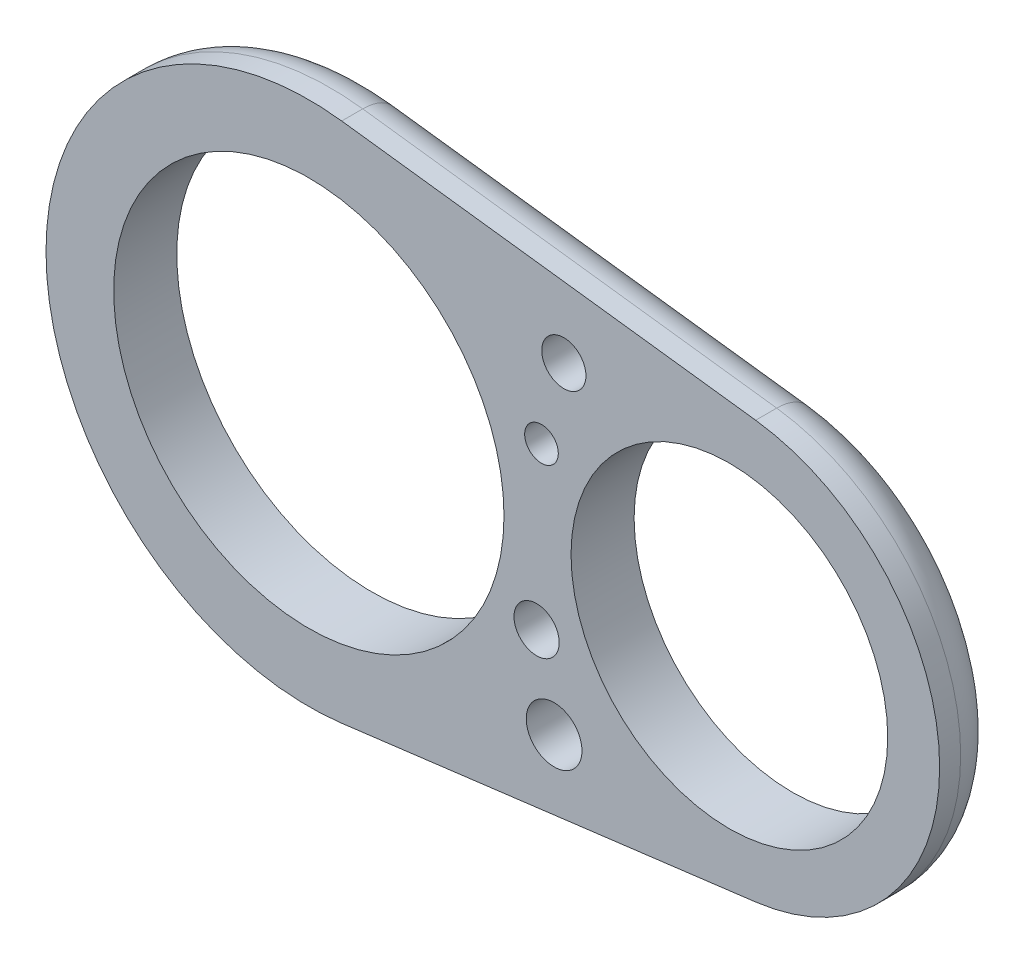
from build123d import *

# Parameters (mm, degrees)
SKETCH1_R           = 2.15
SKETCH1_R_2         = 1.6
SKETCH1_R_3         = 2.1
SKETCH1_R_4         = 2.65
SKETCH1_R_5         = 18.5625
SKETCH1_R_6         = 15.0625
BOSS_EXTRUDE1_DEPTH = 6
FILLET1_R           = 4


with BuildPart() as part:
    # Sketch1 → Boss-Extrude1 (new body)
    with BuildSketch(Plane.XY):
        with BuildLine():
            Line((3.125, -24.803918541), (42.5, -19.843134833))
            ThreePointArc((42.5, -19.843134833), (60, 0), (42.5, 19.843134833))
            Line((42.5, 19.843134833), (3.125, 24.803918541))
            ThreePointArc((3.125, 24.803918541), (-25, 0), (3.125, -24.803918541))
        make_face()
        with Locations((21.663293527, -7.825180806)):
            Circle(SKETCH1_R, mode=Mode.SUBTRACT)
        with Locations((22.126671777, 7.712150618)):
            Circle(SKETCH1_R_2, mode=Mode.SUBTRACT)
        with Locations((24.253343554, 15.424301236)):
            Circle(SKETCH1_R_3, mode=Mode.SUBTRACT)
        with Locations((23.326587053, -15.650361612)):
            Circle(SKETCH1_R_4, mode=Mode.SUBTRACT)
        Circle(SKETCH1_R_5, mode=Mode.SUBTRACT)
        with Locations((40, 0)):
            Circle(SKETCH1_R_6, mode=Mode.SUBTRACT)
    extrude(amount=BOSS_EXTRUDE1_DEPTH)

    # Fillet1
    # the kernel refuses this fillet: 4 mm, written as the material it takes off along each edge
    with BuildSketch(Plane(origin=(0, 0, 0), x_dir=(0.12499999999999982, 0.9921567416492215, 0), z_dir=(0.9921567416492215, -0.12499999999999982, 0))) as fillet1_piece_1:
        with BuildLine():
            CenterArc((25 - FILLET1_R, FILLET1_R), FILLET1_R, 270, 90)
            Line((25 - FILLET1_R, 0), (25, 0))
            Line((25, 0), (25, FILLET1_R))
        make_face()
    revolve(axis=Axis((0, 0, 0), (0, 0, 1)), revolution_arc=194.361511563, mode=Mode.SUBTRACT)
    with BuildSketch(Plane(origin=(42.5, 19.843134833, 0), x_dir=(0, 0, 1), z_dir=(-0.9921567416492215, 0.12500000000000022, 0)), Plane(origin=(3.125, -24.803918541, 0), x_dir=(0, 0, 1), z_dir=(0.9921567416492215, 0.12500000000000014, 0))) as fillet1_piece_2:
        with BuildLine():
            CenterArc((FILLET1_R, -FILLET1_R), FILLET1_R, 90, 90)
            Line((0, -FILLET1_R), (0, 0))
            Line((0, 0), (FILLET1_R, 0))
        make_face()
    extrude(amount=39.686269666, mode=Mode.SUBTRACT)
    with BuildSketch(Plane(origin=(40, 0, 0), x_dir=(0.12499999999999938, -0.9921567416492216, 0), z_dir=(-0.9921567416492216, -0.12499999999999938, 0))) as fillet1_piece_3:
        with BuildLine():
            CenterArc((20 - FILLET1_R, FILLET1_R), FILLET1_R, 270, 90)
            Line((20 - FILLET1_R, 0), (20, 0))
            Line((20, 0), (20, FILLET1_R))
        make_face()
    revolve(axis=Axis((40, 0, 0), (0, 0, 1)), revolution_arc=165.638488437, mode=Mode.SUBTRACT)


solid = part.part
